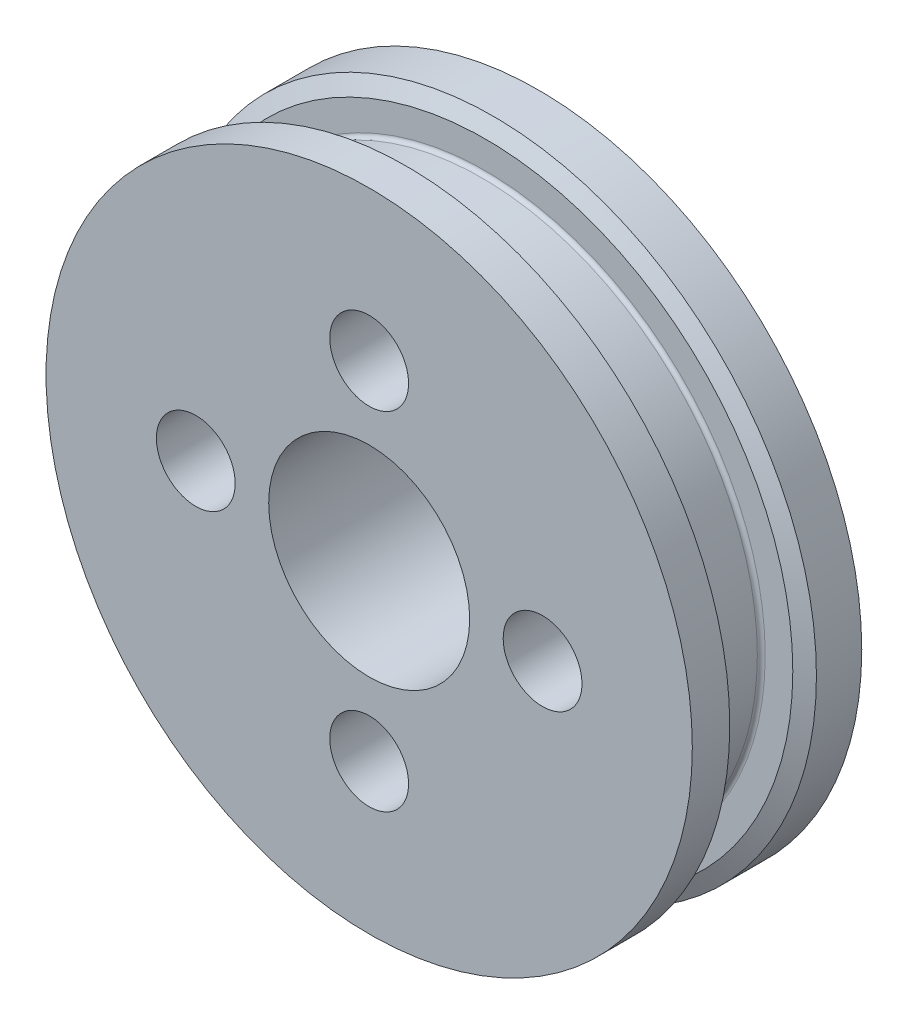
from build123d import *

# Parameters (mm, degrees)
SKETCH3_W               = 16.51
SKETCH3_H               = 16.51
SKETCH3_R               = 6.477
BOSS_EXTRUDE1_DEPTH     = 3.175
CUT_EXTRUDE1_DEPTH      = 32.414984514
CUT_EXTRUDE1_DEPTH_BACK = 32.414984514
SKETCH4_R               = 2.54
FILLET1_R               = 0.254


with BuildPart() as part:
    # Sketch2 → Revolve1 (revolve)
    with BuildSketch(Plane(origin=(0, 0, 0), x_dir=(0, 0, -1), z_dir=(1, 0, 0))):
        Polygon((0, 6.477), (0, 20.828), (2.413, 20.828), (2.921, 19.812), (2.921, 17.78), (7.493, 17.78), (7.493, 19.812), (8.001, 20.828), (10.922, 20.828), (10.922, 6.477), align=None)
    revolve(axis=Axis((0, 0, 0), (0, 0, -1)))

    # Sketch3 → Boss-Extrude1 (add)
    with BuildSketch(Plane(origin=(0, 0, -10.922), x_dir=(-1, 0, 0), z_dir=(0, 0, -1))):
        Rectangle(SKETCH3_W, SKETCH3_H)
        Circle(SKETCH3_R, mode=Mode.SUBTRACT)
    extrude(amount=BOSS_EXTRUDE1_DEPTH)

    # Sketch4 → Cut-Extrude1 (cut, two sides: drawn at the far end of the back side and taken through both)
    with BuildSketch(Plane(origin=(0, 0, -10.922), x_dir=(-1, 0, 0), z_dir=(0, 0, -1)).offset(-CUT_EXTRUDE1_DEPTH_BACK)):
        with Locations((0, 11.176)):
            Circle(SKETCH4_R)
        with Locations((11.176, 0)):
            Circle(SKETCH4_R)
        with Locations((0, -11.176)):
            Circle(SKETCH4_R)
        with Locations((-11.176, 0)):
            Circle(SKETCH4_R)
    extrude(amount=CUT_EXTRUDE1_DEPTH + CUT_EXTRUDE1_DEPTH_BACK, mode=Mode.SUBTRACT)

    # Fillet1
    fillet1_edges = [part.edges().sort_by_distance(p)[0] for p in [
        (0, -17.78, -7.493),
        (0, -17.78, -2.921),
    ]]
    fillet(fillet1_edges, radius=FILLET1_R)


solid = part.part
